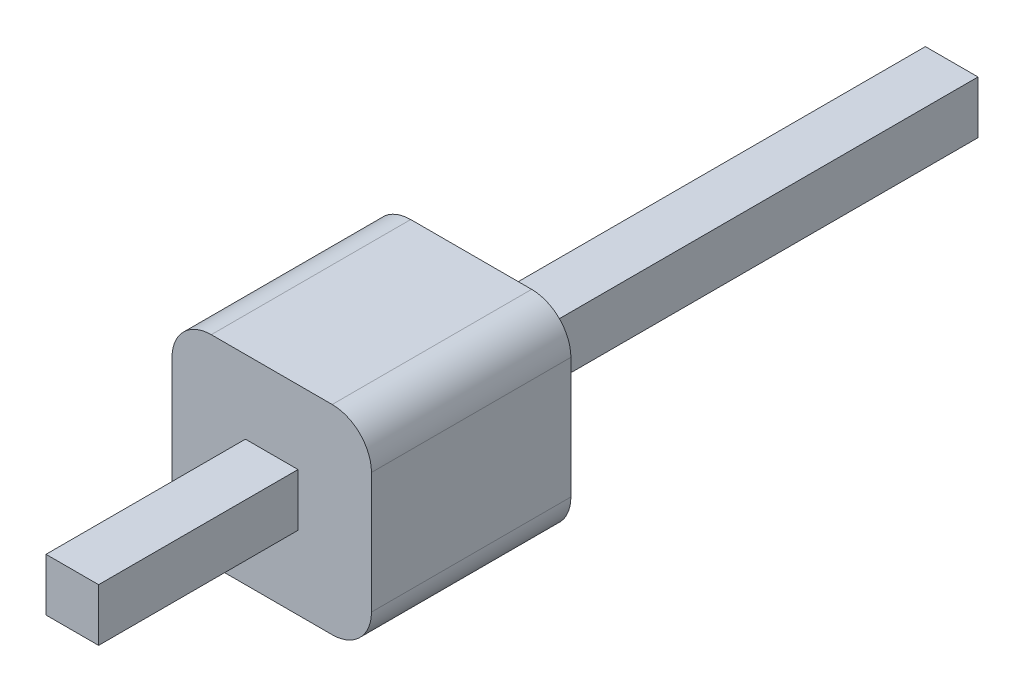
from build123d import *

# Parameters (mm, degrees)
SKETCH_1_W      = 2.54
SKETCH_1_H      = 2.54
EXTRUDE_1_DEPTH = 2.54
SKETCH_2_W      = 0.67
SKETCH_2_H      = 0.67
FILLET_1_R      = 0.5


with BuildPart() as part:
    # 草图1 → 拉伸1 (new body)
    with BuildSketch(Plane.XY):
        with Locations((0, -1.289090726)):
            Rectangle(SKETCH_1_W, SKETCH_1_H)
    extrude(amount=EXTRUDE_1_DEPTH)

    # 扫描1: sweep along a path in 草图3
    with BuildLine(Plane(origin=(0, 0, 0), x_dir=(0, 0, -1), z_dir=(1, 0, 0))) as sweep_1_path:
        Line((6.12, -1.299090726), (-5.08, -1.299090726))
    # 草图2 → 扫描1 (sweep)
    with BuildSketch(Plane(origin=(0, 0, 5.08), x_dir=(-1, 0, 0), z_dir=(0, 0, -1))):
        with Locations((0, -1.289090726)):
            Rectangle(SKETCH_2_W, SKETCH_2_H)
    sweep(path=sweep_1_path.line)

    # 圆角1
    fillet_1_edges = [part.edges().sort_by_distance(p)[0] for p in [
        (1.27, -0.019090726, 1.27),
        (1.27, -2.559090726, 1.27),
        (-1.27, -2.559090726, 1.27),
        (-1.27, -0.019090726, 1.27),
    ]]
    fillet(fillet_1_edges, radius=FILLET_1_R)


solid = part.part
